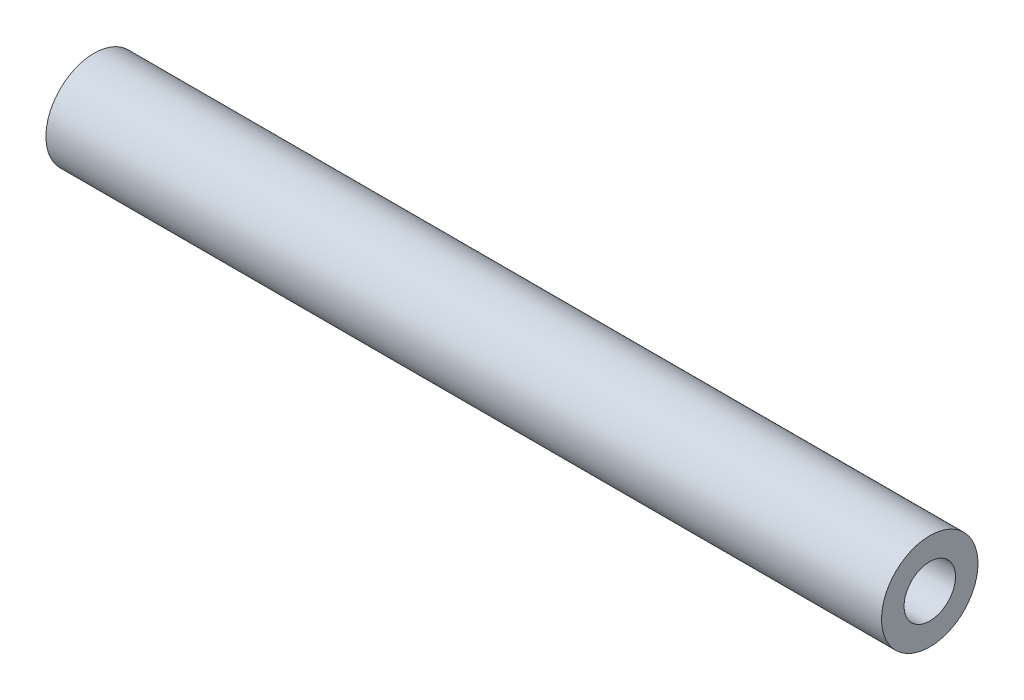
from build123d import *

# Parameters (mm, degrees)
SKETCH1_R           = 4.7625
SKETCH1_R_2         = 2.54
BOSS_EXTRUDE1_DEPTH = 82.55


with BuildPart() as part:
    # Sketch1 → Boss-Extrude1 (new body)
    with BuildSketch(Plane(origin=(0, 0, 0), x_dir=(0, 0, -1), z_dir=(1, 0, 0))):
        Circle(SKETCH1_R)
        Circle(SKETCH1_R_2, mode=Mode.SUBTRACT)
    extrude(amount=BOSS_EXTRUDE1_DEPTH)


solid = part.part
